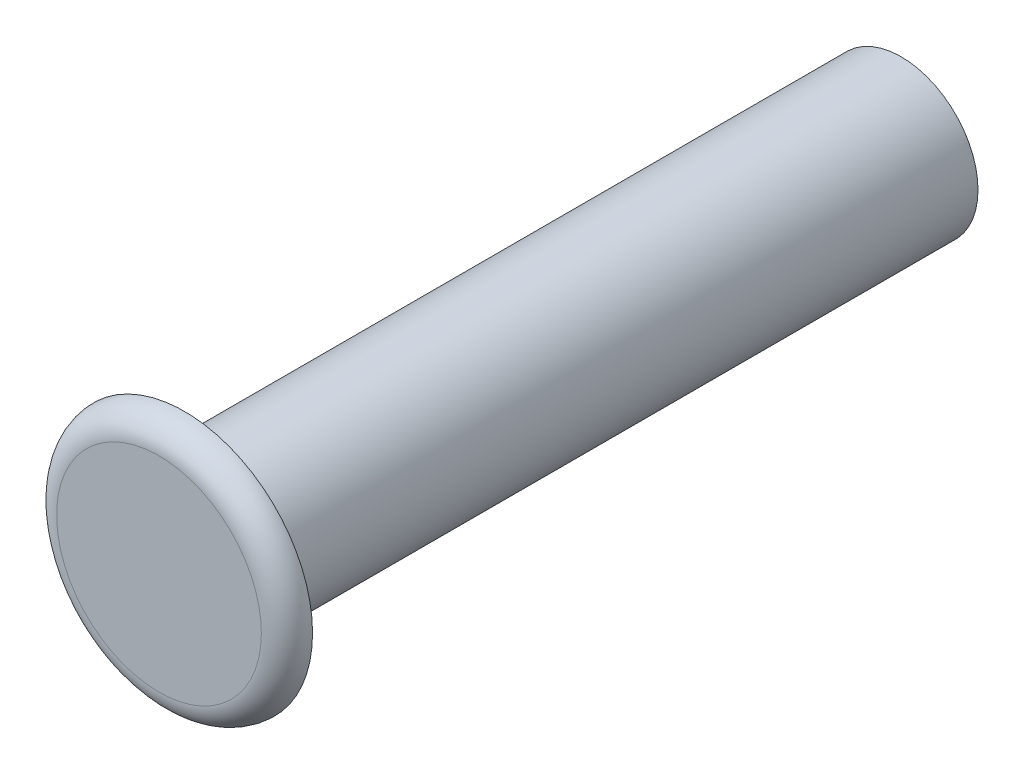
from build123d import *

# Parameters (mm, degrees)
SKETCH_1_R      = 1.5
EXTRUDE_1_DEPTH = 14
SKETCH_2_R      = 2.5
EXTRUDE_2_DEPTH = 0.5
FILLET_1_R      = 0.5


with BuildPart() as part:
    # 草图1 → 凸台-拉伸1 (new body)
    with BuildSketch(Plane.XY):
        Circle(SKETCH_1_R)
    extrude(amount=EXTRUDE_1_DEPTH)

    # 草图2 → 凸台-拉伸2 (add)
    with BuildSketch(Plane.XY.offset(14)):
        Circle(SKETCH_2_R)
    extrude(amount=EXTRUDE_2_DEPTH)

    # 圆角1
    fillet_1_edges = [part.edges().sort_by_distance(p)[0] for p in [
        (-2.5, 0, 14.5),
    ]]
    fillet(fillet_1_edges, radius=FILLET_1_R - 0.0001)  # a hair under: the kernel refuses the full size


solid = part.part
